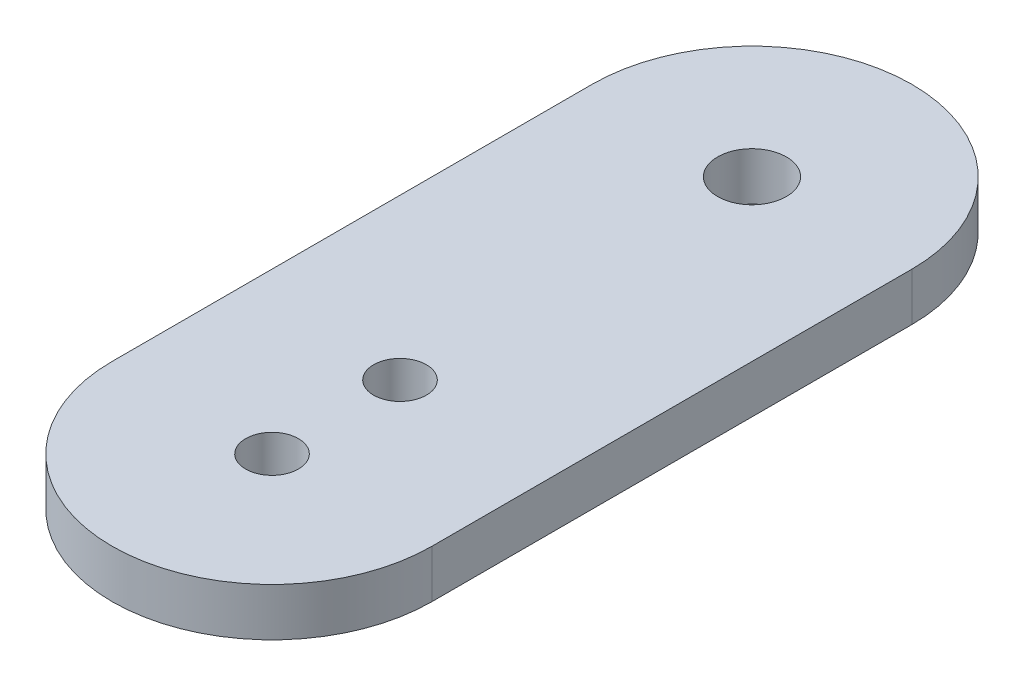
from build123d import *

# Parameters (mm, degrees)
BOSS_EXTRUDE1_DEPTH = 3
SKETCH3_R           = 1.65
SKETCH3_R_2         = 2.15
CUT_EXTRUDE1_DEPTH  = 3
CUT_EXTRUDE2_DEPTH  = 0.5


with BuildPart() as part:
    # Sketch2 → Boss-Extrude1 (new body)
    with BuildSketch(Plane(origin=(0, 0, 0), x_dir=(1, 0, 0), z_dir=(0, 1, 0))):
        with BuildLine():
            Line((-10, 0), (-10, 30))
            ThreePointArc((-10, 30), (0, 40), (10, 30))
            Line((10, 30), (10, 0))
            ThreePointArc((10, 0), (0, -10), (-10, 0))
        make_face()
    extrude(amount=BOSS_EXTRUDE1_DEPTH)

    # Sketch3 → Cut-Extrude1 (cut)
    with BuildSketch(Plane(origin=(0, 3, 0), x_dir=(1, 0, 0), z_dir=(0, 1, 0))):
        Circle(SKETCH3_R)
        with Locations((0, 8)):
            Circle(SKETCH3_R)
        with Locations((0, 30)):
            Circle(SKETCH3_R_2)
    extrude(amount=-CUT_EXTRUDE1_DEPTH, mode=Mode.SUBTRACT)

    # Sketch4 → Cut-Extrude2 (cut)
    # profile 1 of 6: a face of its own
    with BuildSketch(Plane.XZ):
        with BuildLine():
            Line((-3.984014423, -17.192190903), (-4.1671875, -17.365823716))
            add(Edge.make_bspline(
                [(-4.1671875, -17.365823716), (-4.200333744, -17.334642361), (-4.265835839, -17.273023188), (-4.372624862, -17.193073743), (-4.48404262, -17.124584843), (-4.599507729, -17.06885935), (-4.716160781, -17.024396132), (-4.832453395, -16.99274038), (-4.947192703, -16.972552457), (-5.023506471, -16.970138299), (-5.061110276, -16.968948716)],
                knots=[0, 0, 0, 0, 1.08915593, 2.152340314, 3.188132944, 4.216796309, 5.218260357, 6.173443236, 7.099959455, 8, 8, 8, 8], degree=3))
            add(Edge.make_bspline(
                [(-5.061110276, -16.968948716), (-5.084184385, -16.969230116), (-5.130272758, -16.969792185), (-5.198731616, -16.976966017), (-5.266472489, -16.987283541), (-5.333367499, -17.002211854), (-5.399546714, -17.021131946), (-5.464779964, -17.044798485), (-5.529188935, -17.072390535), (-5.59216693, -17.104273754), (-5.653222522, -17.139298435), (-5.710887441, -17.178111817), (-5.765529235, -17.219469904), (-5.816120882, -17.26440816), (-5.862953393, -17.312519524), (-5.907141482, -17.362909023), (-5.947131035, -17.416953341), (-5.983251988, -17.473658133), (-6.015474803, -17.532027462), (-6.043919619, -17.591499514), (-6.067798174, -17.651877029), (-6.086691321, -17.713235771), (-6.102278748, -17.775101048), (-6.113244477, -17.837901224), (-6.119426694, -17.901703542), (-6.120496066, -17.944428105), (-6.121033654, -17.965906348)],
                knots=[0, 0, 0, 0, 1.02818874, 2.053710826, 3.065248034, 4.081641283, 5.106893873, 6.131558223, 7.173050175, 8.228653731, 9.27666206, 10.308777013, 11.325269123, 12.329503258, 13.32196095, 14.316845687, 15.314881793, 16.315733098, 17.311955233, 18.285320748, 19.252783886, 20.203351036, 21.145449891, 22.095197417, 23.042428769, 24, 24, 24, 24], degree=3))
            add(Edge.make_bspline(
                [(-6.121033654, -17.965906348), (-6.120519496, -17.987862029), (-6.119492583, -18.031713437), (-6.112920115, -18.097159762), (-6.100722509, -18.16163408), (-6.084415907, -18.225348256), (-6.064018245, -18.288411409), (-6.038591485, -18.350550135), (-6.008475067, -18.411762133), (-5.973615913, -18.471495869), (-5.935389228, -18.529682068), (-5.892565453, -18.584491315), (-5.847076378, -18.636653465), (-5.797264778, -18.685010368), (-5.744727911, -18.730855483), (-5.68789613, -18.772925723), (-5.627886956, -18.812031442), (-5.564608835, -18.847679788), (-5.498748371, -18.87952631), (-5.43121833, -18.907845425), (-5.361802977, -18.931167617), (-5.290867111, -18.950175506), (-5.218495296, -18.965755887), (-5.144320173, -18.975779235), (-5.068887134, -18.983052818), (-5.018038172, -18.983584633), (-4.992420373, -18.983852562)],
                knots=[0, 0, 0, 0, 0.93586088, 1.869166235, 2.799637598, 3.729985548, 4.670839027, 5.622275134, 6.589130586, 7.576015415, 8.568469353, 9.55398029, 10.53834874, 11.515998671, 12.510579167, 13.508179873, 14.527009472, 15.561807829, 16.601455013, 17.643573243, 18.680854198, 19.719860599, 20.772568776, 21.833555941, 22.908541556, 24, 24, 24, 24], degree=3))
            add(Edge.make_bspline(
                [(-4.992420373, -18.983852562), (-4.96154689, -18.983207191), (-4.900921791, -18.981939901), (-4.811804229, -18.972074526), (-4.726213211, -18.956666618), (-4.644389241, -18.934101963), (-4.566237282, -18.905320356), (-4.491470834, -18.87062528), (-4.420678545, -18.828685985), (-4.3536476, -18.781350907), (-4.291900301, -18.728613137), (-4.236210263, -18.671705035), (-4.187465743, -18.610902832), (-4.144940224, -18.546564645), (-4.109759872, -18.478157928), (-4.080883613, -18.406017917), (-4.058749355, -18.330112163), (-4.049663203, -18.277662321), (-4.045072115, -18.251160254)],
                knots=[0, 0, 0, 0, 1.13008108, 2.219097802, 3.278683437, 4.311054135, 5.322181354, 6.324827112, 7.324222904, 8.330512327, 9.32562643, 10.293043162, 11.24128371, 12.174520618, 13.111833804, 14.052305215, 15.015860969, 16, 16, 16, 16], degree=3))
            Line((-4.045072115, -18.251160254), (-4.838822115, -18.251160254))
            Line((-4.838822115, -18.251160254), (-4.838822115, -18.006929485))
            Line((-4.838822115, -18.006929485), (-3.831370192, -18.006929485))
            add(Edge.make_bspline(
                [(-3.831370192, -18.006929485), (-3.832530778, -18.052450473), (-3.834802255, -18.141543269), (-3.850735482, -18.271471257), (-3.876464216, -18.394188427), (-3.911611678, -18.509824017), (-3.957110753, -18.618214158), (-4.012473134, -18.719468899), (-4.07858488, -18.812934105), (-4.153091091, -18.899372802), (-4.236706956, -18.976477141), (-4.327173106, -19.044244752), (-4.424639008, -19.101328496), (-4.529012466, -19.147770125), (-4.639951797, -19.184015468), (-4.757713712, -19.20971363), (-4.882138515, -19.225110087), (-4.967412219, -19.227077258), (-5.011023888, -19.228083331)],
                knots=[0, 0, 0, 0, 1.140356446, 2.231883559, 3.274166699, 4.278491846, 5.25512956, 6.21435461, 7.1637429, 8.11826594, 9.068280886, 10.0076534, 10.945064095, 11.891975133, 12.864533718, 13.863980011, 14.907571808, 16, 16, 16, 16], degree=3))
            add(Edge.make_bspline(
                [(-5.011023888, -19.228083331), (-5.037904891, -19.227696126), (-5.090922892, -19.226932431), (-5.169225827, -19.221504986), (-5.24536978, -19.213149808), (-5.319343657, -19.200532501), (-5.391419565, -19.185078424), (-5.461237533, -19.165289067), (-5.529063521, -19.142382327), (-5.595002365, -19.116327592), (-5.658455566, -19.086139018), (-5.71970575, -19.052590853), (-5.779091489, -19.015856084), (-5.836208264, -18.975299419), (-5.891353674, -18.93122421), (-5.944172142, -18.883542115), (-5.994959359, -18.832398907), (-6.026773174, -18.796082116), (-6.042803486, -18.77778285)],
                knots=[0, 0, 0, 0, 1.107784379, 2.184907829, 3.233506516, 4.263428166, 5.276301166, 6.270063455, 7.25232949, 8.225834625, 9.190232166, 10.146266622, 11.1027726, 12.066435141, 13.031522626, 14.010570082, 14.99756817, 16, 16, 16, 16], degree=3))
            add(Edge.make_bspline(
                [(-6.042803486, -18.77778285), (-6.066062129, -18.748751567), (-6.112193345, -18.691170889), (-6.171573662, -18.598914498), (-6.222193188, -18.50339109), (-6.263264867, -18.404334745), (-6.295335601, -18.301838116), (-6.318335926, -18.196032177), (-6.331811957, -18.086780678), (-6.333753382, -18.012849489), (-6.334735577, -17.975446612)],
                knots=[0, 0, 0, 0, 1.023165419, 2.029347347, 3.013907458, 3.994755782, 4.975994455, 5.96558838, 6.970761222, 8, 8, 8, 8], degree=3))
            add(Edge.make_bspline(
                [(-6.334735577, -17.975446612), (-6.334373465, -17.947438858), (-6.333653843, -17.891779312), (-6.324927912, -17.809144965), (-6.312408375, -17.727977887), (-6.294006719, -17.648344426), (-6.270809081, -17.570191399), (-6.241857513, -17.493482516), (-6.208149289, -17.418172511), (-6.168970586, -17.344779754), (-6.125370266, -17.274278145), (-6.078051277, -17.206951496), (-6.026341684, -17.1440259), (-5.971085935, -17.08470444), (-5.911624769, -17.029732367), (-5.848515232, -16.978600731), (-5.78170869, -16.931240944), (-5.710994967, -16.888398967), (-5.637429525, -16.849915504), (-5.561188703, -16.816177129), (-5.482295774, -16.788293838), (-5.401341793, -16.764635249), (-5.317713994, -16.747139769), (-5.232019245, -16.734451962), (-5.143810865, -16.725770197), (-5.084187066, -16.725071976), (-5.053955078, -16.724717947)],
                knots=[0, 0, 0, 0, 1.008945113, 2.00506715, 2.99143336, 3.967273523, 4.948097931, 5.927297278, 6.919902385, 7.919676788, 8.923139349, 9.905703106, 10.883022732, 11.856032218, 12.825136022, 13.798837087, 14.781400844, 15.773989409, 16.776158564, 17.77167057, 18.775803737, 19.789618931, 20.80898985, 21.851988756, 22.910860228, 24, 24, 24, 24], degree=3))
            add(Edge.make_bspline(
                [(-5.053955078, -16.724717947), (-5.02930013, -16.725112208), (-4.980412266, -16.725893982), (-4.90766458, -16.731312787), (-4.836041333, -16.739901535), (-4.765436324, -16.751621902), (-4.696089993, -16.767585592), (-4.627804788, -16.786688853), (-4.560481723, -16.808930968), (-4.49433179, -16.835457308), (-4.428910201, -16.865565578), (-4.363853198, -16.899456496), (-4.299383069, -16.937709579), (-4.235388008, -16.980438413), (-4.171464469, -17.026909131), (-4.108623525, -17.078450827), (-4.045348307, -17.133030952), (-4.004661716, -17.172275438), (-3.984014423, -17.192190903)],
                knots=[0, 0, 0, 0, 0.985871117, 1.954866573, 2.915460327, 3.869826059, 4.81536089, 5.759505086, 6.70452669, 7.649098992, 8.607881297, 9.583363685, 10.581137262, 11.603961102, 12.659522466, 13.73993555, 14.853081303, 16, 16, 16, 16], degree=3))
        make_face()
    # profile 2 of 6: a face of its own
    with BuildSketch(Plane.XZ):
        with BuildLine():
            Line((-3.465024038, -17.426881408), (-3.251322115, -17.426881408))
            Line((-3.251322115, -17.426881408), (-3.251322115, -17.683037508))
            add(Edge.make_bspline(
                [(-3.251322115, -17.683037508), (-3.235545478, -17.659187025), (-3.205372781, -17.613573161), (-3.155221663, -17.553246369), (-3.103852432, -17.503297917), (-3.051019171, -17.46349463), (-2.996333356, -17.433686062), (-2.94099518, -17.411851336), (-2.884134012, -17.398939984), (-2.845923846, -17.397216191), (-2.826780349, -17.396352562)],
                knots=[0, 0, 0, 0, 1.2804753, 2.448899062, 3.506932113, 4.484331642, 5.4025378, 6.288909075, 7.142734305, 8, 8, 8, 8], degree=3))
            add(Edge.make_bspline(
                [(-2.826780349, -17.396352562), (-2.811930651, -17.397162545), (-2.781376435, -17.398829138), (-2.735123994, -17.410538646), (-2.687469431, -17.429233515), (-2.656756486, -17.446814095), (-2.640745192, -17.455979215)],
                knots=[0, 0, 0, 0, 0.901110191, 1.854092781, 2.881294221, 4, 4, 4, 4], degree=3))
            Line((-2.640745192, -17.455979215), (-2.758090445, -17.641060344))
            add(Edge.make_bspline(
                [(-2.758090445, -17.641060344), (-2.768369975, -17.636474556), (-2.787882492, -17.627769852), (-2.816426581, -17.617467878), (-2.842743704, -17.611401871), (-2.859510125, -17.6104829), (-2.867326472, -17.610054485)],
                knots=[0, 0, 0, 0, 1.180555205, 2.24091978, 3.179933427, 4, 4, 4, 4], degree=3))
            add(Edge.make_bspline(
                [(-2.867326472, -17.610054485), (-2.884475373, -17.611197511), (-2.91945416, -17.613528951), (-2.970810578, -17.631856961), (-3.020644838, -17.661469669), (-3.060222344, -17.694311265), (-3.090867162, -17.725980392), (-3.112733994, -17.753635823), (-3.132792792, -17.78464557), (-3.151958602, -17.818479516), (-3.169420849, -17.855715357), (-3.185718579, -17.895981079), (-3.200454341, -17.939323319), (-3.208856918, -17.969519283), (-3.213161058, -17.984986877)],
                knots=[0, 0, 0, 0, 1.125678352, 2.296057538, 3.5422874, 4.923748041, 5.663163013, 6.437101912, 7.23742474, 8.08941207, 8.991984279, 9.93940061, 10.944477711, 12, 12, 12, 12], degree=3))
            add(Edge.make_bspline(
                [(-3.213161058, -17.984986877), (-3.216380775, -17.998782597), (-3.223512205, -18.029339068), (-3.230446091, -18.080602975), (-3.237296959, -18.141170857), (-3.242125194, -18.211211307), (-3.246600612, -18.290549416), (-3.249124793, -18.379306051), (-3.251236037, -18.477572313), (-3.251292552, -18.546270935), (-3.251322115, -18.58220743)],
                knots=[0, 0, 0, 0, 0.566838948, 1.255505196, 2.06880316, 3.007127437, 4.065329342, 5.249902469, 6.561414163, 8, 8, 8, 8], degree=3))
            Line((-3.251322115, -18.58220743), (-3.251322115, -19.167025639))
            Line((-3.251322115, -19.167025639), (-3.465024038, -19.167025639))
            Line((-3.465024038, -19.167025639), (-3.465024038, -17.426881408))
        make_face()
    # profile 3 of 6: a face of its own
    with BuildSketch(Plane.XZ):
        with BuildLine():
            add(Edge.make_bspline(
                [(-1.586545974, -17.396352562), (-1.553894768, -17.397047813), (-1.489873734, -17.39841103), (-1.396115155, -17.412980855), (-1.306617482, -17.435260758), (-1.221037948, -17.466061589), (-1.140472575, -17.507346987), (-1.063747854, -17.556611166), (-0.991074139, -17.614973966), (-0.947515614, -17.660121152), (-0.925405649, -17.683037508)],
                knots=[0, 0, 0, 0, 1.054011418, 2.066658804, 3.057071809, 4.030435133, 4.997543892, 5.974964718, 6.972108034, 8, 8, 8, 8], degree=3))
            add(Edge.make_bspline(
                [(-0.925405649, -17.683037508), (-0.906367927, -17.704954523), (-0.868660914, -17.748364399), (-0.820310845, -17.818751165), (-0.778658319, -17.891644697), (-0.745277983, -17.968012968), (-0.718958351, -18.047189306), (-0.700271869, -18.129445853), (-0.689156918, -18.21460095), (-0.687658114, -18.272433919), (-0.686899038, -18.301723656)],
                knots=[0, 0, 0, 0, 1.025258237, 2.030674902, 3.01204498, 3.988269485, 4.97094183, 5.956517959, 6.965070386, 8, 8, 8, 8], degree=3))
            add(Edge.make_bspline(
                [(-0.686899038, -18.301723656), (-0.687566698, -18.331183159), (-0.688886025, -18.389396512), (-0.701366236, -18.475134688), (-0.720777564, -18.558270808), (-0.748557797, -18.638456812), (-0.78418001, -18.715937807), (-0.827648496, -18.790375376), (-0.879268293, -18.861916381), (-0.937781726, -18.929953346), (-1.002450949, -18.992659288), (-1.072606757, -19.0473112), (-1.146870483, -19.094134416), (-1.226229622, -19.131850977), (-1.309959466, -19.161589184), (-1.398240614, -19.18247616), (-1.490935921, -19.195104734), (-1.554227655, -19.196726415), (-1.586545974, -19.197554485)],
                knots=[0, 0, 0, 0, 0.998656419, 1.973391657, 2.932242238, 3.890759089, 4.846373663, 5.82037756, 6.809684879, 7.83454468, 8.860553229, 9.859544525, 10.845671541, 11.83227036, 12.833544569, 13.85385346, 14.904124723, 16, 16, 16, 16], degree=3))
            add(Edge.make_bspline(
                [(-1.586545974, -19.197554485), (-1.619022631, -19.196723636), (-1.682629805, -19.195096375), (-1.775652304, -19.182525223), (-1.864091669, -19.16159881), (-1.947931127, -19.131753248), (-2.02763146, -19.09413321), (-2.102325487, -19.047452757), (-2.172538287, -18.99264308), (-2.237221191, -18.929957737), (-2.295730956, -18.861915249), (-2.347351699, -18.790375669), (-2.390819939, -18.715937731), (-2.426442217, -18.638456833), (-2.454222433, -18.558270803), (-2.473633765, -18.475134689), (-2.486113974, -18.389396512), (-2.487433302, -18.331183159), (-2.488100962, -18.301723656)],
                knots=[0, 0, 0, 0, 1.099876186, 2.154163076, 3.173186993, 4.173200201, 5.163417411, 6.152872554, 7.150605724, 8.17532212, 9.198891216, 10.186952605, 11.159729845, 12.11414092, 13.071450619, 14.029093627, 15.002601286, 16, 16, 16, 16], degree=3))
            add(Edge.make_bspline(
                [(-2.488100962, -18.301723656), (-2.487336709, -18.272593113), (-2.485823621, -18.214919644), (-2.474719846, -18.129924626), (-2.456106257, -18.047807296), (-2.429755075, -17.96893657), (-2.396067061, -17.892902961), (-2.354999828, -17.819829317), (-2.306156558, -17.749760831), (-2.268599516, -17.706407059), (-2.249594351, -17.684468548)],
                knots=[0, 0, 0, 0, 1.031353054, 2.041901799, 3.029428768, 4.008703097, 4.981709435, 5.96992636, 6.972712378, 8, 8, 8, 8], degree=3))
            add(Edge.make_bspline(
                [(-2.249594351, -17.684468548), (-2.22751772, -17.661353455), (-2.184100141, -17.615893558), (-2.111064668, -17.557700894), (-2.034528693, -17.507411566), (-1.953072984, -17.466946498), (-1.867563754, -17.435079577), (-1.777607448, -17.412923397), (-1.683530714, -17.398463525), (-1.6191964, -17.397063229), (-1.586545974, -17.396352562)],
                knots=[0, 0, 0, 0, 1.027980169, 2.021703884, 2.998553061, 3.971491411, 4.943284454, 5.930300938, 6.949603206, 8, 8, 8, 8], degree=3))
        make_face()
        with BuildLine():
            add(Edge.make_bspline(
                [(-1.5875, -17.610054485), (-1.610589696, -17.610710752), (-1.656173032, -17.612006344), (-1.723269571, -17.621860572), (-1.787862783, -17.63747307), (-1.850075214, -17.659655473), (-1.909697069, -17.68829776), (-1.96678543, -17.723477912), (-2.021508215, -17.764729977), (-2.072794941, -17.811989402), (-2.119863621, -17.863614218), (-2.161010244, -17.918619976), (-2.195997683, -17.976114472), (-2.225144291, -18.036157495), (-2.246852574, -18.099357512), (-2.262618505, -18.164998798), (-2.272463437, -18.233215091), (-2.273746848, -18.279588926), (-2.274399038, -18.303154695)],
                knots=[0, 0, 0, 0, 1.021534396, 2.016698045, 2.994645724, 3.958388632, 4.93408049, 5.916473867, 6.921342795, 7.962252576, 8.998418191, 10.008913653, 10.997312074, 11.973003931, 12.956656626, 13.948281152, 14.957379055, 16, 16, 16, 16], degree=3))
            add(Edge.make_bspline(
                [(-2.274399038, -18.303154695), (-2.273305825, -18.333602057), (-2.271135999, -18.394034376), (-2.253490776, -18.483032657), (-2.223972611, -18.568473167), (-2.184112336, -18.64985503), (-2.134169891, -18.725151705), (-2.075327797, -18.792283554), (-2.008217573, -18.850240329), (-1.933639204, -18.898328547), (-1.853115998, -18.936537238), (-1.767896966, -18.963614756), (-1.679014636, -18.981216746), (-1.618271853, -18.982966267), (-1.5875, -18.983852562)],
                knots=[0, 0, 0, 0, 1.016792936, 2.018143844, 3.017858371, 4.030088057, 5.03801393, 6.028138512, 7.003788237, 7.991172063, 8.984598303, 9.972568034, 10.972917682, 12, 12, 12, 12], degree=3))
            add(Edge.make_bspline(
                [(-1.5875, -18.983852562), (-1.556729917, -18.982961103), (-1.495990627, -18.981201389), (-1.407231795, -18.963703406), (-1.322245682, -18.936418594), (-1.241806113, -18.898371519), (-1.167261691, -18.850057716), (-1.099668807, -18.792610824), (-1.041329127, -18.7249739), (-0.991436085, -18.649755295), (-0.950923033, -18.568599334), (-0.921543034, -18.483016888), (-0.90385539, -18.394038392), (-0.901691291, -18.333603402), (-0.900600962, -18.303154695)],
                knots=[0, 0, 0, 0, 1.02726834, 2.027799167, 3.010890988, 4.004497153, 4.992059811, 5.971914811, 6.958719428, 7.966827853, 8.981595046, 9.981490638, 10.983022906, 12, 12, 12, 12], degree=3))
            add(Edge.make_bspline(
                [(-0.900600962, -18.303154695), (-0.901252927, -18.279588786), (-0.902535897, -18.233214673), (-0.912384042, -18.165000396), (-0.928138079, -18.099351649), (-0.949890197, -18.036179126), (-0.97891016, -17.975959011), (-1.0145723, -17.918788786), (-1.055550908, -17.863423672), (-1.103187556, -17.812156284), (-1.154420747, -17.764711554), (-1.209165711, -17.723461916), (-1.266169419, -17.688452373), (-1.325618062, -17.659410484), (-1.38783847, -17.637674883), (-1.452341177, -17.621770425), (-1.519151439, -17.612047988), (-1.564571431, -17.610723236), (-1.5875, -17.610054485)],
                knots=[0, 0, 0, 0, 1.042956736, 2.052379634, 3.044323526, 4.02829302, 5.004299113, 5.996692471, 7.007513377, 8.048758398, 9.090003419, 10.095195979, 11.07790575, 12.047570684, 13.018257071, 13.989683339, 14.985167495, 16, 16, 16, 16], degree=3))
        make_face(mode=Mode.SUBTRACT)
    # profile 4 of 6: a face of its own
    with BuildSketch(Plane.XZ):
        with BuildLine():
            Line((-0.290024038, -17.426881408), (-0.076322115, -17.426881408))
            Line((-0.076322115, -17.426881408), (-0.076322115, -18.233987778))
            add(Edge.make_bspline(
                [(-0.076322115, -18.233987778), (-0.076225569, -18.257679684), (-0.076040881, -18.303001191), (-0.074788384, -18.368216952), (-0.071842374, -18.427691537), (-0.06815904, -18.481459303), (-0.063422301, -18.529511153), (-0.057786657, -18.571679251), (-0.051487624, -18.608441794), (-0.045321742, -18.630582899), (-0.042454177, -18.640880056)],
                knots=[0, 0, 0, 0, 1.388932606, 2.656963016, 3.823490214, 4.879454478, 5.816252168, 6.653371382, 7.373723809, 8, 8, 8, 8], degree=3))
            add(Edge.make_bspline(
                [(-0.042454177, -18.640880056), (-0.037853972, -18.653822402), (-0.028749201, -18.679438026), (-0.012234563, -18.716441974), (0.00819543, -18.750715158), (0.030551849, -18.783579178), (0.056336981, -18.81406053), (0.085224586, -18.842107739), (0.116247672, -18.868780522), (0.162345286, -18.900338747), (0.22538668, -18.934162927), (0.308154001, -18.963347403), (0.397895983, -18.980788917), (0.459920551, -18.982812472), (0.491800631, -18.983852562)],
                knots=[0, 0, 0, 0, 0.725840625, 1.436591201, 2.137033971, 2.831655856, 3.53531722, 4.242432219, 4.957935707, 5.694543706, 7.190802206, 8.724350549, 10.316345118, 12, 12, 12, 12], degree=3))
            add(Edge.make_bspline(
                [(0.491800631, -18.983852562), (0.52367775, -18.982790355), (0.585354076, -18.980735182), (0.674110046, -18.963873525), (0.755243598, -18.935702868), (0.827940406, -18.896373183), (0.891870736, -18.848243315), (0.945145707, -18.791767679), (0.989101714, -18.728733007), (1.008294195, -18.68170381), (1.017946214, -18.658052532)],
                knots=[0, 0, 0, 0, 1.157059328, 2.238695713, 3.266970494, 4.264342957, 5.228770407, 6.160125903, 7.074715775, 8, 8, 8, 8], degree=3))
            add(Edge.make_bspline(
                [(1.017946214, -18.658052532), (1.020799788, -18.648550461), (1.027108344, -18.627543702), (1.033886301, -18.591906766), (1.03999214, -18.549408527), (1.045205837, -18.499770888), (1.048924099, -18.443123568), (1.05092845, -18.37948427), (1.053192866, -18.309052773), (1.053227235, -18.259748816), (1.053245192, -18.233987778)],
                knots=[0, 0, 0, 0, 0.557542046, 1.232589297, 2.036731608, 2.971723315, 4.038036528, 5.22795436, 6.551621927, 8, 8, 8, 8], degree=3))
            Line((1.053245192, -18.233987778), (1.053245192, -17.426881408))
            Line((1.053245192, -17.426881408), (1.266947115, -17.426881408))
            Line((1.266947115, -17.426881408), (1.266947115, -18.274056889))
            add(Edge.make_bspline(
                [(1.266947115, -18.274056889), (1.266646605, -18.302840875), (1.266063574, -18.358685746), (1.262316614, -18.439841543), (1.255887502, -18.515471571), (1.246129354, -18.585615861), (1.234654672, -18.650220862), (1.219852636, -18.709369375), (1.202178157, -18.76287916), (1.18223994, -18.811689191), (1.158684705, -18.85594431), (1.133629179, -18.897946714), (1.104697147, -18.936654229), (1.074237398, -18.973993683), (1.040354486, -19.008107829), (1.003683332, -19.039779458), (0.964740083, -19.069492717), (0.92266054, -19.096088748), (0.878059004, -19.120048644), (0.830880416, -19.141286726), (0.780546915, -19.158093301), (0.727707905, -19.172592165), (0.672104507, -19.183963973), (0.613790325, -19.191983048), (0.552785002, -19.196898853), (0.511208745, -19.197332271), (0.489892578, -19.197554485)],
                knots=[0, 0, 0, 0, 1.493040784, 2.896703357, 4.213163133, 5.428574705, 6.569057535, 7.615249723, 8.588095153, 9.490268104, 10.346124644, 11.18633936, 12.024365274, 12.850166724, 13.684164916, 14.514361689, 15.362232829, 16.222528818, 17.093394965, 17.986930858, 18.902426812, 19.842810585, 20.827885679, 21.843828298, 22.894529745, 24, 24, 24, 24], degree=3))
            add(Edge.make_bspline(
                [(0.489892578, -19.197554485), (0.468735843, -19.197323363), (0.427160888, -19.196869186), (0.366152416, -19.192010206), (0.307676668, -19.183976433), (0.25194154, -19.172508866), (0.198891102, -19.158194784), (0.148310467, -19.14118345), (0.1007919, -19.120037622), (0.055764501, -19.096240391), (0.013580733, -19.069321874), (-0.025953853, -19.039816118), (-0.062786247, -19.007767172), (-0.096924574, -18.97330888), (-0.127889653, -18.936013786), (-0.156067352, -18.896181896), (-0.181891468, -18.854207882), (-0.205263634, -18.809261338), (-0.225342168, -18.759886453), (-0.24306904, -18.705255749), (-0.257567886, -18.644770287), (-0.269366958, -18.578481778), (-0.27885892, -18.506707473), (-0.285448956, -18.429032176), (-0.289133655, -18.345645093), (-0.289720845, -18.288052936), (-0.290024038, -18.258315453)],
                knots=[0, 0, 0, 0, 1.083640291, 2.129454052, 3.13281866, 4.105697902, 5.042300162, 5.946461698, 6.836384745, 7.703652036, 8.553297018, 9.397182691, 10.228592656, 11.052265423, 11.879314572, 12.708807002, 13.549817954, 14.402308542, 15.300838682, 16.27712199, 17.341985831, 18.484375296, 19.725102775, 21.0496083, 22.476576903, 24, 24, 24, 24], degree=3))
            Line((-0.290024038, -18.258315453), (-0.290024038, -17.426881408))
        make_face()
    # profile 5 of 6: a face of its own
    with BuildSketch(Plane.XZ):
        with BuildLine():
            Line((1.755408654, -17.426881408), (1.969110577, -17.426881408))
            Line((1.969110577, -17.426881408), (1.969110577, -17.748865332))
            add(Edge.make_bspline(
                [(1.969110577, -17.748865332), (1.991805579, -17.719652339), (2.035908775, -17.662882731), (2.111921612, -17.589410876), (2.192153959, -17.527447142), (2.278670495, -17.478881526), (2.370126613, -17.442264152), (2.466146993, -17.415199919), (2.567546581, -17.399251345), (2.636872561, -17.397331607), (2.672228065, -17.396352562)],
                knots=[0, 0, 0, 0, 1.0828784, 2.104357462, 3.088488658, 4.04616522, 5.001424249, 5.969181776, 6.964304535, 8, 8, 8, 8], degree=3))
            add(Edge.make_bspline(
                [(2.672228065, -17.396352562), (2.703110566, -17.397245993), (2.764151453, -17.399011905), (2.854001614, -17.410967858), (2.940526295, -17.431458646), (3.023235988, -17.460986768), (3.103016752, -17.497491651), (3.178687502, -17.543563419), (3.251426904, -17.596907631), (3.319405597, -17.65829772), (3.382217098, -17.724719808), (3.436541018, -17.796172483), (3.48339851, -17.870305957), (3.521274194, -17.948269505), (3.550943445, -18.029449196), (3.572044502, -18.11417301), (3.584602292, -18.202126819), (3.586287163, -18.261932063), (3.587139423, -18.292183391)],
                knots=[0, 0, 0, 0, 1.041296284, 2.058176809, 3.050446431, 4.034000596, 5.01514041, 6.003636468, 7.015969324, 8.052561599, 9.08815499, 10.094063707, 11.074456064, 12.040834395, 13.011057502, 13.983766392, 14.980127149, 16, 16, 16, 16], degree=3))
            add(Edge.make_bspline(
                [(3.587139423, -18.292183391), (3.586305655, -18.323073176), (3.584661345, -18.38399229), (3.571908046, -18.473450476), (3.551526673, -18.559507064), (3.52223173, -18.642018916), (3.484375646, -18.720929222), (3.438312365, -18.796181074), (3.383961036, -18.867750361), (3.321843662, -18.934665459), (3.25445229, -18.996305349), (3.182417783, -19.050215535), (3.10685805, -19.095487435), (3.028159665, -19.133303699), (2.945648918, -19.161805346), (2.859710777, -19.182364242), (2.770392031, -19.195042354), (2.709635354, -19.196710687), (2.67890625, -19.197554485)],
                knots=[0, 0, 0, 0, 1.038740735, 2.04854663, 3.033179607, 4.009277356, 4.987731542, 5.972001279, 6.972200261, 8.005528982, 9.039189865, 10.040446548, 11.026516639, 11.997840187, 12.972163198, 13.956796175, 14.96660207, 16, 16, 16, 16], degree=3))
            add(Edge.make_bspline(
                [(2.67890625, -19.197554485), (2.644325348, -19.196673553), (2.576017929, -19.194933455), (2.476143086, -19.177298999), (2.38002437, -19.150944048), (2.288726684, -19.112368483), (2.201526798, -19.063208927), (2.118917965, -19.003262519), (2.040461389, -18.932654629), (1.993238645, -18.879088876), (1.969110577, -18.8517199)],
                knots=[0, 0, 0, 0, 1.014726462, 2.004382257, 2.969841629, 3.936926163, 4.907207904, 5.903978561, 6.929055279, 8, 8, 8, 8], degree=3))
            Line((1.969110577, -18.8517199), (1.969110577, -19.808131408))
            Line((1.969110577, -19.808131408), (1.755408654, -19.808131408))
            Line((1.755408654, -19.808131408), (1.755408654, -17.426881408))
        make_face()
        with BuildLine():
            add(Edge.make_bspline(
                [(2.670320012, -17.610054485), (2.646113203, -17.610490089), (2.598456234, -17.611347682), (2.528602457, -17.621535315), (2.461318246, -17.636324742), (2.397281704, -17.658716589), (2.335879052, -17.68620221), (2.277583219, -17.720548007), (2.222435124, -17.761132675), (2.170573519, -17.8071788), (2.123721886, -17.857916222), (2.082245322, -17.912064356), (2.047406066, -17.96955463), (2.018489513, -18.029851528), (1.99648453, -18.093427695), (1.980866442, -18.159921049), (1.971048648, -18.229404367), (1.969763496, -18.276727293), (1.969110577, -18.300769629)],
                knots=[0, 0, 0, 0, 1.05670511, 2.080379991, 3.077984906, 4.06214886, 5.038337365, 6.01289324, 7.01187578, 8.025460281, 9.038092164, 10.024533457, 11.000252242, 11.969694649, 12.940728589, 13.933144304, 14.949937299, 16, 16, 16, 16], degree=3))
            add(Edge.make_bspline(
                [(1.969110577, -18.300769629), (1.970192927, -18.332330113), (1.972313343, -18.394159774), (1.989551802, -18.484500399), (2.017606509, -18.569988401), (2.057426937, -18.649903856), (2.107737698, -18.723370749), (2.168356265, -18.789154894), (2.238734143, -18.846842778), (2.317701286, -18.895434739), (2.402352771, -18.934887334), (2.490653544, -18.963131823), (2.581389293, -18.980530071), (2.642735953, -18.982739068), (2.673659105, -18.983852562)],
                knots=[0, 0, 0, 0, 1.03728447, 2.032128127, 3.01272805, 3.987917167, 4.958271349, 5.931593992, 6.91984656, 7.941419022, 8.973179163, 9.983609215, 10.983593296, 12, 12, 12, 12], degree=3))
            add(Edge.make_bspline(
                [(2.673659105, -18.983852562), (2.703959332, -18.98279367), (2.764099837, -18.980691959), (2.852653845, -18.962500442), (2.938712654, -18.934711238), (3.020478093, -18.894189469), (3.097238359, -18.844530161), (3.166554202, -18.784958067), (3.227110691, -18.715908659), (3.278725547, -18.639022517), (3.32031679, -18.55657998), (3.351565756, -18.471275856), (3.369601054, -18.383410845), (3.372157012, -18.32422133), (3.3734375, -18.294568457)],
                knots=[0, 0, 0, 0, 1.00104056, 1.986885549, 2.97790532, 3.984399681, 4.995088187, 5.994304198, 6.996462723, 8.023150851, 9.048424203, 10.043036403, 11.019596776, 12, 12, 12, 12], degree=3))
            add(Edge.make_bspline(
                [(3.3734375, -18.294568457), (3.372447761, -18.264731402), (3.370475995, -18.205289753), (3.351053814, -18.117684992), (3.321866508, -18.032036208), (3.27930401, -17.950719549), (3.228820647, -17.873992896), (3.167760636, -17.806260703), (3.099305688, -17.746953513), (3.022636811, -17.697957315), (2.940354128, -17.658982719), (2.853734516, -17.630486886), (2.763217351, -17.613359746), (2.701558179, -17.61116593), (2.670320012, -17.610054485)],
                knots=[0, 0, 0, 0, 0.983928682, 1.960191568, 2.949917689, 3.96440592, 4.982380491, 5.975291189, 6.965713506, 7.964880129, 8.970154049, 9.96478489, 10.968906225, 12, 12, 12, 12], degree=3))
        make_face(mode=Mode.SUBTRACT)
    # profile 6 of 6: a face of its own
    with BuildSketch(Plane.XZ):
        with BuildLine():
            Line((5.083052885, -17.33529487), (4.869350962, -17.33529487))
            add(Edge.make_bspline(
                [(4.869350962, -17.33529487), (4.875140495, -17.311324198), (4.88645856, -17.264463494), (4.910065302, -17.197511411), (4.935782295, -17.134154158), (4.966663096, -17.07557808), (5.000346731, -17.020605969), (5.03893844, -16.970484654), (5.080657751, -16.923939404), (5.12680294, -16.882632719), (5.175195833, -16.845228229), (5.226518315, -16.813336449), (5.27973782, -16.785901623), (5.335223076, -16.763300001), (5.393139275, -16.746273707), (5.452962822, -16.733920595), (5.514850489, -16.725898426), (5.556860904, -16.725115496), (5.578192608, -16.724717947)],
                knots=[0, 0, 0, 0, 1.162005537, 2.271625781, 3.343758855, 4.383309926, 5.390229558, 6.379919256, 7.361854164, 8.333198761, 9.295911338, 10.242430842, 11.177959212, 12.116337295, 13.062827104, 14.020064771, 14.994644689, 16, 16, 16, 16], degree=3))
            add(Edge.make_bspline(
                [(5.578192608, -16.724717947), (5.609273188, -16.725656316), (5.67075639, -16.727512586), (5.761082677, -16.7444633), (5.848186638, -16.771286471), (5.931114859, -16.80834806), (6.008143828, -16.854059429), (6.076680412, -16.908464008), (6.135795631, -16.970512105), (6.185389842, -17.039046224), (6.224221225, -17.112290419), (6.25285499, -17.187674097), (6.270286883, -17.265018439), (6.272546048, -17.317240802), (6.273677885, -17.343404094)],
                knots=[0, 0, 0, 0, 1.083050992, 2.142477498, 3.193116406, 4.255571735, 5.30263384, 6.308962982, 7.297363603, 8.282367274, 9.249857812, 10.179914175, 11.08814088, 12, 12, 12, 12], degree=3))
            add(Edge.make_bspline(
                [(6.273677885, -17.343404094), (6.272886227, -17.368581932), (6.271337076, -17.417851052), (6.258183252, -17.489779427), (6.236046973, -17.557571302), (6.205383438, -17.621512057), (6.165690347, -17.681196278), (6.117607673, -17.73675825), (6.060796041, -17.78844441), (6.017743763, -17.818053194), (5.995579177, -17.833296673)],
                knots=[0, 0, 0, 0, 1.024540389, 2.004866551, 2.965041327, 3.920577974, 4.882998113, 5.874504559, 6.905732034, 8, 8, 8, 8], degree=3))
            add(Edge.make_bspline(
                [(5.995579177, -17.833296673), (6.020910067, -17.84552825), (6.071097887, -17.869762543), (6.139508158, -17.917289406), (6.201609712, -17.972164528), (6.236242421, -18.014988012), (6.253643329, -18.036504305)],
                knots=[0, 0, 0, 0, 1.015518401, 2.012035669, 3.001164323, 4, 4, 4, 4], degree=3))
            add(Edge.make_bspline(
                [(6.253643329, -18.036504305), (6.265101457, -18.052191811), (6.287830077, -18.083309929), (6.315884967, -18.133340962), (6.341336525, -18.183926528), (6.361169085, -18.236422481), (6.376527377, -18.290220371), (6.387505642, -18.345412573), (6.394325637, -18.402044156), (6.395302325, -18.440356754), (6.395793269, -18.459615032)],
                knots=[0, 0, 0, 0, 1.025084078, 2.033381695, 3.024893161, 4.013698104, 4.991890475, 5.976764909, 6.982997093, 8, 8, 8, 8], degree=3))
            add(Edge.make_bspline(
                [(6.395793269, -18.459615032), (6.394572359, -18.492959146), (6.392136285, -18.559490456), (6.370362084, -18.657784864), (6.336607361, -18.753868644), (6.288671482, -18.845767775), (6.230250909, -18.93175157), (6.160747444, -19.008683845), (6.080950798, -19.07481361), (5.99195624, -19.130065568), (5.89553798, -19.17423294), (5.792412443, -19.204888093), (5.684065531, -19.224853854), (5.609765566, -19.226994849), (5.571991436, -19.228083331)],
                knots=[0, 0, 0, 0, 0.955779014, 1.907060117, 2.875433937, 3.871313158, 4.872415639, 5.851225146, 6.836215519, 7.83643374, 8.849228613, 9.86973379, 10.916971861, 12, 12, 12, 12], degree=3))
            add(Edge.make_bspline(
                [(5.571991436, -19.228083331), (5.546532948, -19.227492636), (5.496439133, -19.226330345), (5.422794895, -19.218384725), (5.352499239, -19.203872704), (5.28545712, -19.184344205), (5.221608979, -19.159584824), (5.16114965, -19.128751924), (5.103707169, -19.092481062), (5.049823597, -19.050344104), (4.999505357, -19.003208049), (4.954089665, -18.950236116), (4.912819341, -18.892407525), (4.876799439, -18.829050588), (4.844389298, -18.760984083), (4.817732254, -18.687336444), (4.794269751, -18.608766065), (4.783361269, -18.554012459), (4.777764423, -18.52591987)],
                knots=[0, 0, 0, 0, 1.048658725, 2.063410685, 3.046034179, 4.001477787, 4.936774919, 5.862367409, 6.792675028, 7.730719943, 8.675894397, 9.627829632, 10.600096036, 11.597688215, 12.626045268, 13.701542398, 14.82072376, 16, 16, 16, 16], degree=3))
            Line((4.777764423, -18.52591987), (4.991466346, -18.52591987))
            add(Edge.make_bspline(
                [(4.991466346, -18.52591987), (4.997033907, -18.544254823), (5.007863296, -18.579917901), (5.026297095, -18.631244252), (5.047298545, -18.678296427), (5.069828271, -18.721419587), (5.093490036, -18.761038418), (5.119966083, -18.796105297), (5.147295448, -18.828160461), (5.167896222, -18.846220277), (5.177978516, -18.855058992)],
                knots=[0, 0, 0, 0, 1.198163088, 2.33053128, 3.407730985, 4.417276592, 5.372219308, 6.28897303, 7.162600585, 8, 8, 8, 8], degree=3))
            add(Edge.make_bspline(
                [(5.177978516, -18.855058992), (5.191311186, -18.865338055), (5.217935373, -18.885864452), (5.261320545, -18.91205931), (5.306948619, -18.934756722), (5.355808246, -18.952094736), (5.40684508, -18.966775252), (5.460884056, -18.976382248), (5.517448416, -18.982973664), (5.556070769, -18.983555323), (5.575807542, -18.983852562)],
                knots=[0, 0, 0, 0, 0.946170439, 1.889420265, 2.845303464, 3.807233317, 4.801018734, 5.828864929, 6.890507805, 8, 8, 8, 8], degree=3))
            add(Edge.make_bspline(
                [(5.575807542, -18.983852562), (5.598091622, -18.983433526), (5.641666215, -18.982614139), (5.705248896, -18.975078702), (5.765737713, -18.96410426), (5.822461079, -18.947154535), (5.876162013, -18.926212562), (5.926087743, -18.899917844), (5.972893665, -18.869067238), (6.015980278, -18.834002204), (6.054723561, -18.795615437), (6.088836337, -18.755465472), (6.11783633, -18.713721595), (6.141229443, -18.670152802), (6.159701514, -18.624939513), (6.172276691, -18.577954845), (6.181020312, -18.529583312), (6.181732382, -18.496702353), (6.182091346, -18.4801266)],
                knots=[0, 0, 0, 0, 1.217147791, 2.380027433, 3.494444702, 4.572153297, 5.609568379, 6.639424714, 7.649109417, 8.668170816, 9.669597737, 10.625200337, 11.543417969, 12.441394052, 13.322311151, 14.205496177, 15.095365482, 16, 16, 16, 16], degree=3))
            add(Edge.make_bspline(
                [(6.182091346, -18.4801266), (6.181050195, -18.457939243), (6.178973072, -18.41367493), (6.163114914, -18.348552794), (6.137030793, -18.285807937), (6.100514317, -18.226510873), (6.056062687, -18.171554411), (6.004107277, -18.122520063), (5.944216644, -18.082059162), (5.889094197, -18.054104201), (5.84026826, -18.035028977), (5.798483865, -18.022323331), (5.751704818, -18.011564398), (5.70049682, -18.001554799), (5.644474025, -17.99303581), (5.583697423, -17.985931646), (5.5181547, -17.980247234), (5.472780889, -17.977708757), (5.449399038, -17.976400639)],
                knots=[0, 0, 0, 0, 1.07054697, 2.135767047, 3.216561865, 4.33974944, 5.486079747, 6.621378074, 7.775625952, 8.963672916, 9.598146892, 10.304877434, 11.070270905, 11.915000392, 12.823868403, 13.805723172, 14.86925407, 16, 16, 16, 16], degree=3))
            Line((5.449399038, -17.976400639), (5.449399038, -17.73216987))
            add(Edge.make_bspline(
                [(5.449399038, -17.73216987), (5.478859296, -17.731669941), (5.536564703, -17.730690703), (5.620857078, -17.718847038), (5.701461242, -17.702463611), (5.776590865, -17.677368507), (5.845067936, -17.648221805), (5.904476451, -17.614304498), (5.9539841, -17.576602678), (5.993350293, -17.53453442), (6.022965714, -17.489416504), (6.044619303, -17.442392492), (6.05741024, -17.39305023), (6.059117709, -17.359376179), (6.059975962, -17.342450068)],
                knots=[0, 0, 0, 0, 1.321986639, 2.589447074, 3.816329219, 5.01088745, 6.139805852, 7.153945165, 8.075214402, 8.924034688, 9.728124013, 10.488707548, 11.240355623, 12, 12, 12, 12], degree=3))
            add(Edge.make_bspline(
                [(6.059975962, -17.342450068), (6.059694014, -17.330014674), (6.059133093, -17.305275046), (6.052059231, -17.269131026), (6.041429303, -17.23409199), (6.026815416, -17.200306944), (6.007255013, -17.168010204), (5.983846654, -17.136926422), (5.955973714, -17.107233065), (5.924034044, -17.079555919), (5.889736012, -17.053178991), (5.852146433, -17.030785963), (5.812398694, -17.011637269), (5.770448787, -16.995846519), (5.726160578, -16.983967967), (5.679742152, -16.975439118), (5.631104996, -16.970106714), (5.5979228, -16.969338988), (5.581054687, -16.968948716)],
                knots=[0, 0, 0, 0, 0.884392785, 1.759457502, 2.611959086, 3.489218968, 4.37281399, 5.2945488, 6.255912374, 7.266815255, 8.301784654, 9.332968512, 10.37626691, 11.440494194, 12.520033166, 13.637162961, 14.798855837, 16, 16, 16, 16], degree=3))
            add(Edge.make_bspline(
                [(5.581054687, -16.968948716), (5.553941321, -16.969895339), (5.500982609, -16.971744314), (5.424636388, -16.987938864), (5.353661984, -17.013777525), (5.299411213, -17.044620168), (5.259350033, -17.075066445), (5.230722688, -17.101656426), (5.202609983, -17.131206258), (5.176861407, -17.165535974), (5.150821433, -17.202320701), (5.127114687, -17.243430384), (5.104078004, -17.28779266), (5.090196983, -17.319154154), (5.083052885, -17.33529487)],
                knots=[0, 0, 0, 0, 1.472543308, 2.876219568, 4.221790263, 5.565193594, 6.249813518, 6.953379497, 7.687249741, 8.463570142, 9.283606569, 10.136032583, 11.040678096, 12, 12, 12, 12], degree=3))
        make_face()
    extrude(amount=-CUT_EXTRUDE2_DEPTH, mode=Mode.SUBTRACT)


solid = part.part
